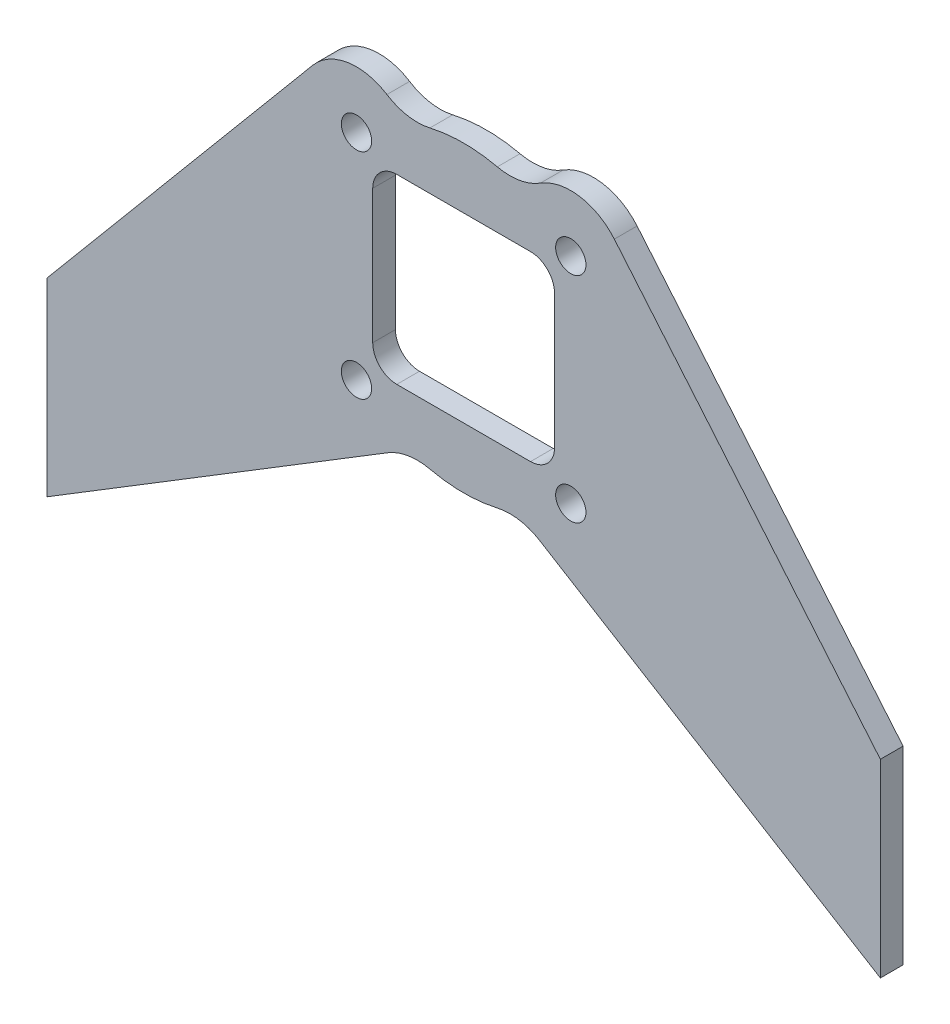
from build123d import *

# Parameters (mm, degrees)
SKETCH1_R           = 2
BOSS_EXTRUDE1_DEPTH = 3


with BuildPart() as part:
    # Sketch1 → Boss-Extrude1 (new body)
    with BuildSketch(Plane.XY):
        with BuildLine():
            Line((-54.999999618, -47.940229662), (-10.227120183, -20.53921731))
            ThreePointArc((-10.227120183, -20.53921731), (-10.177124819, -20.508350301), (-10.127372804, -20.477092569))
            ThreePointArc((-10.127372804, -20.477092569), (-7.384123474, -19.420618432), (-4.445534534, -19.499672374))
            ThreePointArc((-4.445534534, -19.499672374), (0, -20), (4.445534534, -19.499672374))
            ThreePointArc((4.445534534, -19.499672374), (7.384123474, -19.420618432), (10.127372804, -20.477092569))
            ThreePointArc((10.127372804, -20.477092569), (10.177124805, -20.508350292), (10.227120156, -20.539217293))
            Line((10.227120156, -20.539217293), (54.999999618, -47.940229927))
            Line((54.999999618, -47.940229927), (54.999999618, -22.940229927))
            Line((54.999999618, -22.940229927), (19.89074335, 18.959137721))
            ThreePointArc((19.89074335, 18.959137721), (15.294351433, 21.553100388), (10.127372804, 20.477092569))
            ThreePointArc((10.127372804, 20.477092569), (7.384123474, 19.420618432), (4.445534534, 19.499672374))
            ThreePointArc((4.445534534, 19.499672374), (0, 20), (-4.445534534, 19.499672374))
            ThreePointArc((-4.445534534, 19.499672374), (-7.384123474, 19.420618432), (-10.127372804, 20.477092569))
            ThreePointArc((-10.127372804, 20.477092569), (-15.294351421, 21.553100389), (-19.890743335, 18.959137739))
            Line((-19.890743335, 18.959137739), (-54.999999618, -22.940229662))
            Line((-54.999999618, -22.940229662), (-54.999999618, -47.940229662))
        make_face()
        with BuildLine():
            Line((8.825, -12), (-8.825, -12))
            ThreePointArc((-8.825, -12), (-11.07006403, -11.07006403), (-12, -8.825))
            Line((-12, -8.825), (-12, 8.825))
            ThreePointArc((-12, 8.825), (-11.07006403, 11.07006403), (-8.825, 12))
            Line((-8.825, 12), (8.825, 12))
            ThreePointArc((8.825, 12), (11.07006403, 11.07006403), (12, 8.825))
            Line((12, 8.825), (12, -8.825))
            ThreePointArc((12, -8.825), (11.07006403, -11.07006403), (8.825, -12))
        make_face(mode=Mode.SUBTRACT)
        with Locations((14.142135624, 14.142135624)):
            Circle(SKETCH1_R, mode=Mode.SUBTRACT)
        with Locations((-14.142135624, -14.142135624)):
            Circle(SKETCH1_R, mode=Mode.SUBTRACT)
        with Locations((14.142135624, -14.142135624)):
            Circle(SKETCH1_R, mode=Mode.SUBTRACT)
        with Locations((-14.142135624, 14.142135624)):
            Circle(SKETCH1_R, mode=Mode.SUBTRACT)
    extrude(amount=BOSS_EXTRUDE1_DEPTH)


solid = part.part
